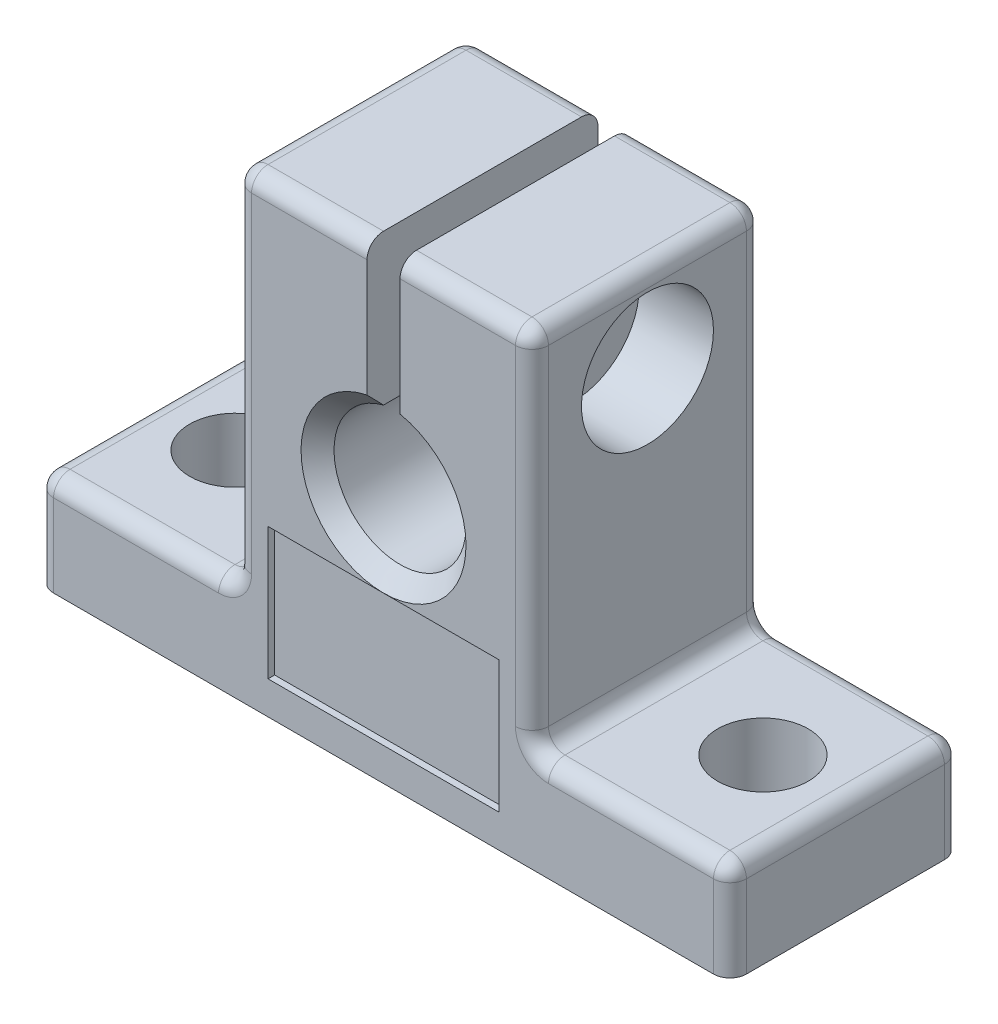
from build123d import *

# Parameters (mm, degrees)
BOSS_EXTRUDE1_DEPTH                        = 7
CUT_EXTRUDE1_REACH                         = 39.696
SKETCH2_R                                  = 4
DIAMETER_HOLE1_D                           = 5.5
CBORE_START                                = 4.5
CBORE_FOR_SOCKET_HEAD_CAP_SCREW1_OUTLINE_R = 4
CBORE_FOR_SOCKET_HEAD_CAP_SCREW1_DEPTH     = 4.5
CBORE_FOR_SOCKET_HEAD_CAP_SCREW1_2_OUTLI_R = 2.25
CBORE_FOR_SOCKET_HEAD_CAP_SCREW1_2_DEPTH   = 4.5
TAPPED_HOLE1_D                             = 3.3
CUT_EXTRUDE2_REACH                         = 39.696
SKETCH9_W                                  = 2
SKETCH9_H                                  = 13
SKETCH10_W                                 = 14
SKETCH10_H                                 = 8
CUT_EXTRUDE3_DEPTH                         = 0.4
FILLET1_R                                  = 1
CHAMFER1_SIZE                              = 1


# Read off the part's stored shape, not the designer's step: CBORE for Socket Head Cap Screw1
with BuildPart() as part:
    # Sketch1 → Boss-Extrude1 (new, symmetric)
    with BuildSketch(Plane.XY):
        Polygon((-21, 0), (21, 0), (21, 6), (9, 6), (9, 28), (-9, 28), (-9, 6), (-21, 6), align=None)
    extrude(amount=BOSS_EXTRUDE1_DEPTH, both=True)

    # Sketch2 → Cut-Extrude1 (cut, up to next)
    with BuildSketch(Plane.XY.offset(7), mode=Mode.PRIVATE) as cut_extrude1_sk1:
        with Locations((0, 15)):
            Circle(SKETCH2_R)
    cut_extrude1_tool1 = extrude(cut_extrude1_sk1.sketch, amount=-CUT_EXTRUDE1_REACH, mode=Mode.PRIVATE) & part.part
    add(cut_extrude1_tool1.solids().sort_by_distance((0, 15, 7))[0], mode=Mode.SUBTRACT)

    # Diameter Hole1 (through all)
    with Locations(Plane(origin=(0, 6, 0), x_dir=(1, 0, 0), z_dir=(0, 1, 0))):
        with Locations((-16, 0), (16, 0)):
            Hole(DIAMETER_HOLE1_D / 2)

    # CBORE for Socket Head Cap Screw1 outline → CBORE for Socket Head Cap Screw1 (cut)
    with BuildSketch(Plane.YZ.offset(CBORE_START)):
        with Locations((22.8, 0)):
            Circle(CBORE_FOR_SOCKET_HEAD_CAP_SCREW1_OUTLINE_R)
    extrude(amount=CBORE_FOR_SOCKET_HEAD_CAP_SCREW1_DEPTH, mode=Mode.SUBTRACT)

    # CBORE for Socket Head Cap Screw1 2 outli → CBORE for Socket Head Cap Screw1 2 (cut)
    with BuildSketch(Plane.YZ):
        with Locations((22.8, 0)):
            Circle(CBORE_FOR_SOCKET_HEAD_CAP_SCREW1_2_OUTLI_R)
    extrude(amount=CBORE_FOR_SOCKET_HEAD_CAP_SCREW1_2_DEPTH, mode=Mode.SUBTRACT)

    # Tapped Hole1 (through all)
    with Locations(Plane(origin=(-9, -2.558166827, -1.433608379), x_dir=(0, 0, -1), z_dir=(-1, 0, 0))):
        with Locations((-1.433608379, -25.358166827)):
            Hole(TAPPED_HOLE1_D / 2)

    # Sketch9 → Cut-Extrude2 (cut, up to next)
    with BuildSketch(Plane.XY.offset(7), mode=Mode.PRIVATE) as cut_extrude2_sk1:
        with Locations((0, 21.5)):
            Rectangle(SKETCH9_W, SKETCH9_H)
    cut_extrude2_tool1 = extrude(cut_extrude2_sk1.sketch, amount=-CUT_EXTRUDE2_REACH, mode=Mode.PRIVATE) & part.part
    add(cut_extrude2_tool1.solids().sort_by_distance((0, 21.5, 7))[0], mode=Mode.SUBTRACT)

    # Sketch10 → Cut-Extrude3 (cut)
    with BuildSketch(Plane.XY.offset(7)):
        with Locations((0, 6)):
            Rectangle(SKETCH10_W, SKETCH10_H)
    extrude(amount=-CUT_EXTRUDE3_DEPTH, mode=Mode.SUBTRACT)

    # Fillet1
    fillet1_edges = [part.edges().sort_by_distance(p)[0] for p in [
        (21, 3, 7),
        (-21, 3, -7),
        (15, 6, 7),
        (-21, 6, 0),
        (-9, 6, 0),
        (-9, 28, 0),
        (9, 28, 0),
        (9, 6, 0),
        (21, 6, 0),
        (9, 17, 7),
        (5, 28, 7),
        (-9, 17, 7),
        (-15, 6, 7),
        (-21, 3, 7),
        (-5, 28, -7),
        (-5, 28, 7),
        (-15, 6, -7),
        (-9, 17, -7),
        (5, 28, -7),
        (9, 17, -7),
        (15, 6, -7),
        (21, 3, -7),
    ]]
    fillet(fillet1_edges, radius=FILLET1_R)

    # Chamfer1
    chamfer1_edges = [part.edges().sort_by_distance(p)[0] for p in [
        (0, 11, 7),
        (0, 11, -7),
    ]]
    chamfer(chamfer1_edges, length=CHAMFER1_SIZE - 0.0001)  # a hair under: the kernel refuses the full size


solid = part.part
